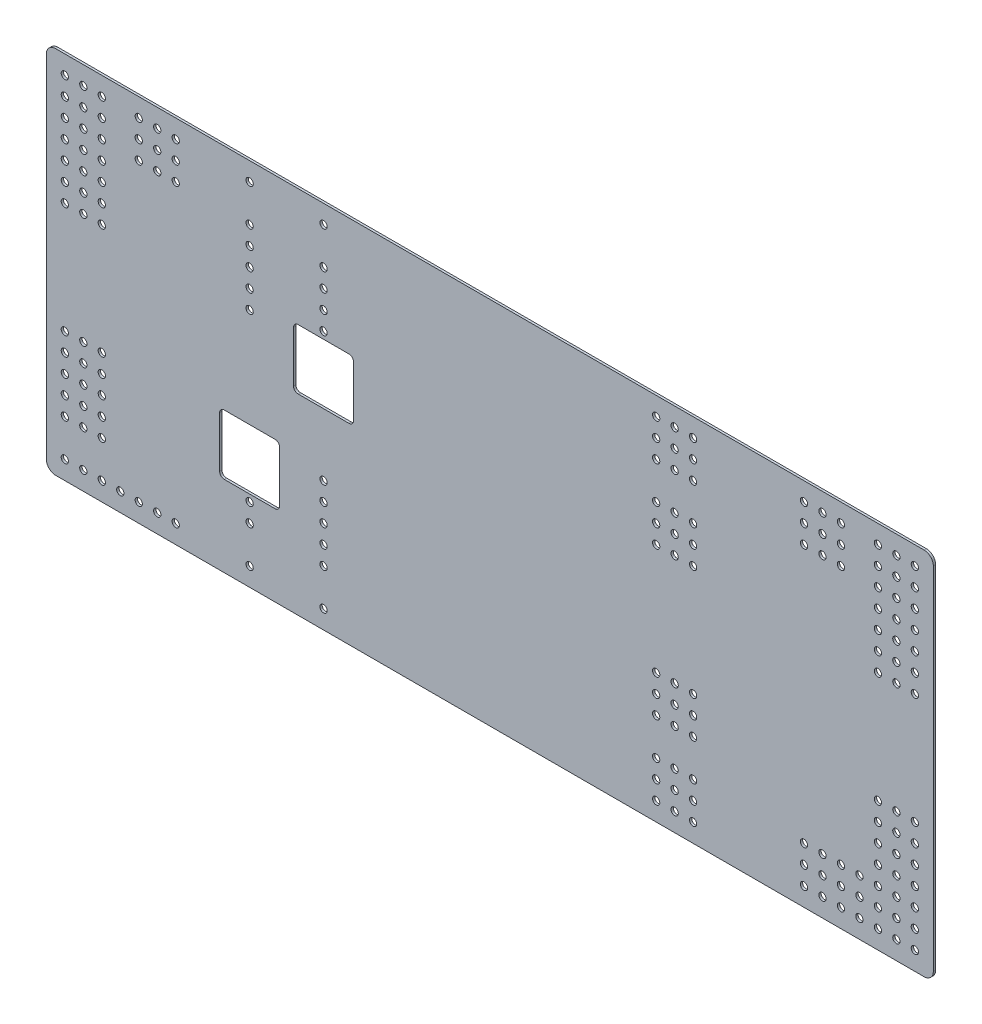
from build123d import *

# Parameters (mm, degrees)
BOSS_EXTRUDE1_DEPTH = 1.5875
SKETCH2_R           = 2.5
CUT_EXTRUDE1_DEPTH  = 474.010623106
CUT_EXTRUDE2_DEPTH  = 474.010623106


with BuildPart() as part:
    # Sketch1 → Boss-Extrude1 (new body)
    with BuildSketch(Plane.XY):
        with BuildLine():
            Line((-148.965673289, 122.233995585), (447.934326711, 122.233995585))
            ThreePointArc((447.934326711, 122.233995585), (452.424454771, 120.374123646), (454.284326711, 115.883995585))
            Line((454.284326711, 115.883995585), (454.284326711, -125.416004415))
            ThreePointArc((454.284326711, -125.416004415), (452.424454771, -129.906132476), (447.934326711, -131.766004415))
            Line((447.934326711, -131.766004415), (-148.965673289, -131.766004415))
            ThreePointArc((-148.965673289, -131.766004415), (-153.45580135, -129.906132476), (-155.315673289, -125.416004415))
            Line((-155.315673289, -125.416004415), (-155.315673289, 115.883995585))
            ThreePointArc((-155.315673289, 115.883995585), (-153.45580135, 120.374123646), (-148.965673289, 122.233995585))
        make_face()
    extrude(amount=BOSS_EXTRUDE1_DEPTH)

    # Sketch2 → Cut-Extrude1 (cut, through all)
    with BuildSketch(Plane.XY.offset(1.5875)):
        with Locations((-142.615673289, 109.533995585)):
            Circle(SKETCH2_R)
        with Locations((-129.915673289, 109.533995585)):
            Circle(SKETCH2_R)
        with Locations((-117.215673289, 109.533995585)):
            Circle(SKETCH2_R)
        with Locations((-91.815673289, 109.533995585)):
            Circle(SKETCH2_R)
        with Locations((-79.115673289, 109.533995585)):
            Circle(SKETCH2_R)
        with Locations((-66.415673289, 109.533995585)):
            Circle(SKETCH2_R)
        with Locations((-129.915673289, 96.833995585)):
            Circle(SKETCH2_R)
        with Locations((-117.215673289, 96.833995585)):
            Circle(SKETCH2_R)
        with Locations((-91.815673289, 96.833995585)):
            Circle(SKETCH2_R)
        with Locations((-79.115673289, 96.833995585)):
            Circle(SKETCH2_R)
        with Locations((-66.415673289, 96.833995585)):
            Circle(SKETCH2_R)
        with Locations((-129.915673289, 84.133995585)):
            Circle(SKETCH2_R)
        with Locations((-117.215673289, 84.133995585)):
            Circle(SKETCH2_R)
        with Locations((-91.815673289, 84.133995585)):
            Circle(SKETCH2_R)
        with Locations((-79.115673289, 84.133995585)):
            Circle(SKETCH2_R)
        with Locations((-66.415673289, 84.133995585)):
            Circle(SKETCH2_R)
        with Locations((-142.615673289, 96.833995585)):
            Circle(SKETCH2_R)
        with Locations((-142.615673289, 84.133995585)):
            Circle(SKETCH2_R)
        with Locations((-142.615673289, 71.433995585)):
            Circle(SKETCH2_R)
        with Locations((-129.915673289, 71.433995585)):
            Circle(SKETCH2_R)
        with Locations((-117.215673289, 71.433995585)):
            Circle(SKETCH2_R)
        with Locations((-129.915673289, 58.733995585)):
            Circle(SKETCH2_R)
        with Locations((-117.215673289, 58.733995585)):
            Circle(SKETCH2_R)
        with Locations((-129.915673289, 46.033995585)):
            Circle(SKETCH2_R)
        with Locations((-117.215673289, 46.033995585)):
            Circle(SKETCH2_R)
        with Locations((-129.915673289, 33.333995585)):
            Circle(SKETCH2_R)
        with Locations((-117.215673289, 33.333995585)):
            Circle(SKETCH2_R)
        with Locations((-142.615673289, 58.733995585)):
            Circle(SKETCH2_R)
        with Locations((-142.615673289, 46.033995585)):
            Circle(SKETCH2_R)
        with Locations((-142.615673289, 33.333995585)):
            Circle(SKETCH2_R)
        with Locations((-142.615673289, -42.866004415)):
            Circle(SKETCH2_R)
        with Locations((-142.615673289, -55.566004415)):
            Circle(SKETCH2_R)
        with Locations((-142.615673289, -68.266004415)):
            Circle(SKETCH2_R)
        with Locations((-117.215673289, -42.866004415)):
            Circle(SKETCH2_R)
        with Locations((-129.915673289, -42.866004415)):
            Circle(SKETCH2_R)
        with Locations((-117.215673289, -55.566004415)):
            Circle(SKETCH2_R)
        with Locations((-129.915673289, -55.566004415)):
            Circle(SKETCH2_R)
        with Locations((-117.215673289, -68.266004415)):
            Circle(SKETCH2_R)
        with Locations((-129.915673289, -68.266004415)):
            Circle(SKETCH2_R)
        with Locations((-117.215673289, -80.966004415)):
            Circle(SKETCH2_R)
        with Locations((-129.915673289, -80.966004415)):
            Circle(SKETCH2_R)
        with Locations((-142.615673289, -80.966004415)):
            Circle(SKETCH2_R)
        with Locations((-142.615673289, -93.666004415)):
            Circle(SKETCH2_R)
        with Locations((-117.215673289, -93.666004415)):
            Circle(SKETCH2_R)
        with Locations((-129.915673289, -93.666004415)):
            Circle(SKETCH2_R)
        with Locations((-66.415673289, -119.066004415)):
            Circle(SKETCH2_R)
        with Locations((-79.115673289, -119.066004415)):
            Circle(SKETCH2_R)
        with Locations((-91.815673289, -119.066004415)):
            Circle(SKETCH2_R)
        with Locations((-104.515673289, -119.066004415)):
            Circle(SKETCH2_R)
        with Locations((-117.215673289, -119.066004415)):
            Circle(SKETCH2_R)
        with Locations((-129.915673289, -119.066004415)):
            Circle(SKETCH2_R)
        with Locations((-142.615673289, -119.066004415)):
            Circle(SKETCH2_R)
        with Locations((441.584326711, -119.066004415)):
            Circle(SKETCH2_R)
        with Locations((428.884326711, -119.066004415)):
            Circle(SKETCH2_R)
        with Locations((416.184326711, -119.066004415)):
            Circle(SKETCH2_R)
        with Locations((403.484326711, -119.066004415)):
            Circle(SKETCH2_R)
        with Locations((390.784326711, -119.066004415)):
            Circle(SKETCH2_R)
        with Locations((378.084326711, -119.066004415)):
            Circle(SKETCH2_R)
        with Locations((365.384326711, -119.066004415)):
            Circle(SKETCH2_R)
        with Locations((428.884326711, -106.366004415)):
            Circle(SKETCH2_R)
        with Locations((416.184326711, -106.366004415)):
            Circle(SKETCH2_R)
        with Locations((403.484326711, -106.366004415)):
            Circle(SKETCH2_R)
        with Locations((390.784326711, -106.366004415)):
            Circle(SKETCH2_R)
        with Locations((378.084326711, -106.366004415)):
            Circle(SKETCH2_R)
        with Locations((365.384326711, -106.366004415)):
            Circle(SKETCH2_R)
        with Locations((428.884326711, -93.666004415)):
            Circle(SKETCH2_R)
        with Locations((416.184326711, -93.666004415)):
            Circle(SKETCH2_R)
        with Locations((403.484326711, -93.666004415)):
            Circle(SKETCH2_R)
        with Locations((390.784326711, -93.666004415)):
            Circle(SKETCH2_R)
        with Locations((378.084326711, -93.666004415)):
            Circle(SKETCH2_R)
        with Locations((365.384326711, -93.666004415)):
            Circle(SKETCH2_R)
        with Locations((441.584326711, -106.366004415)):
            Circle(SKETCH2_R)
        with Locations((441.584326711, -93.666004415)):
            Circle(SKETCH2_R)
        with Locations((441.584326711, -80.966004415)):
            Circle(SKETCH2_R)
        with Locations((428.884326711, -80.966004415)):
            Circle(SKETCH2_R)
        with Locations((416.184326711, -80.966004415)):
            Circle(SKETCH2_R)
        with Locations((428.884326711, -68.266004415)):
            Circle(SKETCH2_R)
        with Locations((416.184326711, -68.266004415)):
            Circle(SKETCH2_R)
        with Locations((428.884326711, -55.566004415)):
            Circle(SKETCH2_R)
        with Locations((416.184326711, -55.566004415)):
            Circle(SKETCH2_R)
        with Locations((428.884326711, -42.866004415)):
            Circle(SKETCH2_R)
        with Locations((416.184326711, -42.866004415)):
            Circle(SKETCH2_R)
        with Locations((441.584326711, -68.266004415)):
            Circle(SKETCH2_R)
        with Locations((441.584326711, -55.566004415)):
            Circle(SKETCH2_R)
        with Locations((441.584326711, -42.866004415)):
            Circle(SKETCH2_R)
        with Locations((441.584326711, 33.333995585)):
            Circle(SKETCH2_R)
        with Locations((441.584326711, 46.033995585)):
            Circle(SKETCH2_R)
        with Locations((441.584326711, 58.733995585)):
            Circle(SKETCH2_R)
        with Locations((416.184326711, 33.333995585)):
            Circle(SKETCH2_R)
        with Locations((416.184326711, 46.033995585)):
            Circle(SKETCH2_R)
        with Locations((416.184326711, 58.733995585)):
            Circle(SKETCH2_R)
        with Locations((416.184326711, 71.433995585)):
            Circle(SKETCH2_R)
        with Locations((441.584326711, 71.433995585)):
            Circle(SKETCH2_R)
        with Locations((441.584326711, 84.133995585)):
            Circle(SKETCH2_R)
        with Locations((441.584326711, 96.833995585)):
            Circle(SKETCH2_R)
        with Locations((365.384326711, 84.133995585)):
            Circle(SKETCH2_R)
        with Locations((378.084326711, 84.133995585)):
            Circle(SKETCH2_R)
        with Locations((390.784326711, 84.133995585)):
            Circle(SKETCH2_R)
        with Locations((416.184326711, 84.133995585)):
            Circle(SKETCH2_R)
        with Locations((428.884326711, 84.133995585)):
            Circle(SKETCH2_R)
        with Locations((365.384326711, 96.833995585)):
            Circle(SKETCH2_R)
        with Locations((378.084326711, 96.833995585)):
            Circle(SKETCH2_R)
        with Locations((390.784326711, 96.833995585)):
            Circle(SKETCH2_R)
        with Locations((416.184326711, 96.833995585)):
            Circle(SKETCH2_R)
        with Locations((428.884326711, 96.833995585)):
            Circle(SKETCH2_R)
        with Locations((365.384326711, 109.533995585)):
            Circle(SKETCH2_R)
        with Locations((378.084326711, 109.533995585)):
            Circle(SKETCH2_R)
        with Locations((390.784326711, 109.533995585)):
            Circle(SKETCH2_R)
        with Locations((416.184326711, 109.533995585)):
            Circle(SKETCH2_R)
        with Locations((428.884326711, 109.533995585)):
            Circle(SKETCH2_R)
        with Locations((441.584326711, 109.533995585)):
            Circle(SKETCH2_R)
        with Locations((-15.615673289, 109.533995585)):
            Circle(SKETCH2_R)
        with Locations((35.184326711, 109.533995585)):
            Circle(SKETCH2_R)
        with Locations((-15.615673289, 84.133995585)):
            Circle(SKETCH2_R)
        with Locations((35.184326711, 84.133995585)):
            Circle(SKETCH2_R)
        with Locations((-15.615673289, 71.433995585)):
            Circle(SKETCH2_R)
        with Locations((35.184326711, 71.433995585)):
            Circle(SKETCH2_R)
        with Locations((-15.615673289, 58.733995585)):
            Circle(SKETCH2_R)
        with Locations((35.184326711, 58.733995585)):
            Circle(SKETCH2_R)
        with Locations((-15.615673289, 46.033995585)):
            Circle(SKETCH2_R)
        with Locations((35.184326711, 46.033995585)):
            Circle(SKETCH2_R)
        with Locations((-15.615673289, 33.333995585)):
            Circle(SKETCH2_R)
        with Locations((35.184326711, 33.333995585)):
            Circle(SKETCH2_R)
        with Locations((35.184326711, -42.866004415)):
            Circle(SKETCH2_R)
        with Locations((-15.615673289, -42.866004415)):
            Circle(SKETCH2_R)
        with Locations((35.184326711, -55.566004415)):
            Circle(SKETCH2_R)
        with Locations((-15.615673289, -55.566004415)):
            Circle(SKETCH2_R)
        with Locations((35.184326711, -68.266004415)):
            Circle(SKETCH2_R)
        with Locations((-15.615673289, -68.266004415)):
            Circle(SKETCH2_R)
        with Locations((35.184326711, -80.966004415)):
            Circle(SKETCH2_R)
        with Locations((-15.615673289, -80.966004415)):
            Circle(SKETCH2_R)
        with Locations((35.184326711, -93.666004415)):
            Circle(SKETCH2_R)
        with Locations((-15.615673289, -93.666004415)):
            Circle(SKETCH2_R)
        with Locations((35.184326711, -119.066004415)):
            Circle(SKETCH2_R)
        with Locations((-15.615673289, -119.066004415)):
            Circle(SKETCH2_R)
        with Locations((289.184326711, 109.533995585)):
            Circle(SKETCH2_R)
        with Locations((276.484326711, 109.533995585)):
            Circle(SKETCH2_R)
        with Locations((263.784326711, 109.533995585)):
            Circle(SKETCH2_R)
        with Locations((276.484326711, 96.833995585)):
            Circle(SKETCH2_R)
        with Locations((263.784326711, 96.833995585)):
            Circle(SKETCH2_R)
        with Locations((276.484326711, 84.133995585)):
            Circle(SKETCH2_R)
        with Locations((263.784326711, 84.133995585)):
            Circle(SKETCH2_R)
        with Locations((276.484326711, 58.733995585)):
            Circle(SKETCH2_R)
        with Locations((263.784326711, 58.733995585)):
            Circle(SKETCH2_R)
        with Locations((276.484326711, 46.033995585)):
            Circle(SKETCH2_R)
        with Locations((263.784326711, 46.033995585)):
            Circle(SKETCH2_R)
        with Locations((276.484326711, 33.333995585)):
            Circle(SKETCH2_R)
        with Locations((263.784326711, 33.333995585)):
            Circle(SKETCH2_R)
        with Locations((289.184326711, 96.833995585)):
            Circle(SKETCH2_R)
        with Locations((289.184326711, 84.133995585)):
            Circle(SKETCH2_R)
        with Locations((289.184326711, 58.733995585)):
            Circle(SKETCH2_R)
        with Locations((289.184326711, 46.033995585)):
            Circle(SKETCH2_R)
        with Locations((289.184326711, 33.333995585)):
            Circle(SKETCH2_R)
        with Locations((289.184326711, -42.866004415)):
            Circle(SKETCH2_R)
        with Locations((289.184326711, -55.566004415)):
            Circle(SKETCH2_R)
        with Locations((289.184326711, -68.266004415)):
            Circle(SKETCH2_R)
        with Locations((289.184326711, -106.366004415)):
            Circle(SKETCH2_R)
        with Locations((263.784326711, -42.866004415)):
            Circle(SKETCH2_R)
        with Locations((276.484326711, -42.866004415)):
            Circle(SKETCH2_R)
        with Locations((263.784326711, -55.566004415)):
            Circle(SKETCH2_R)
        with Locations((276.484326711, -55.566004415)):
            Circle(SKETCH2_R)
        with Locations((263.784326711, -68.266004415)):
            Circle(SKETCH2_R)
        with Locations((276.484326711, -68.266004415)):
            Circle(SKETCH2_R)
        with Locations((263.784326711, -106.366004415)):
            Circle(SKETCH2_R)
        with Locations((276.484326711, -106.366004415)):
            Circle(SKETCH2_R)
        with Locations((263.784326711, -119.066004415)):
            Circle(SKETCH2_R)
        with Locations((276.484326711, -119.066004415)):
            Circle(SKETCH2_R)
        with Locations((289.184326711, -119.066004415)):
            Circle(SKETCH2_R)
        with Locations((428.884326711, 71.433995585)):
            Circle(SKETCH2_R)
        with Locations((428.884326711, 58.733995585)):
            Circle(SKETCH2_R)
        with Locations((428.884326711, 46.033995585)):
            Circle(SKETCH2_R)
        with Locations((428.884326711, 33.333995585)):
            Circle(SKETCH2_R)
        with Locations((289.184326711, -93.666004415)):
            Circle(SKETCH2_R)
        with Locations((276.484326711, -93.666004415)):
            Circle(SKETCH2_R)
        with Locations((263.784326711, -93.666004415)):
            Circle(SKETCH2_R)
    extrude(amount=-CUT_EXTRUDE1_DEPTH, mode=Mode.SUBTRACT)

    # Sketch3 → Cut-Extrude2 (cut, through all)
    with BuildSketch(Plane(origin=(0, 0, 0), x_dir=(-1, 0, 0), z_dir=(0, 0, -1))):
        with BuildLine():
            Line((-1.846826711, -34.928504415), (33.078173289, -34.928504415))
            ThreePointArc((33.078173289, -34.928504415), (35.323237319, -35.858440385), (36.253173289, -38.103504415))
            Line((36.253173289, -38.103504415), (36.253173289, -73.028504415))
            ThreePointArc((36.253173289, -73.028504415), (35.323237319, -75.273568445), (33.078173289, -76.203504415))
            Line((33.078173289, -76.203504415), (-1.846826711, -76.203504415))
            ThreePointArc((-1.846826711, -76.203504415), (-4.091890741, -75.273568445), (-5.021826711, -73.028504415))
            Line((-5.021826711, -73.028504415), (-5.021826711, -38.103504415))
            ThreePointArc((-5.021826711, -38.103504415), (-4.091890741, -35.858440385), (-1.846826711, -34.928504415))
        make_face()
        with BuildLine():
            Line((-52.646826711, 41.271495585), (-17.721826711, 41.271495585))
            ThreePointArc((-17.721826711, 41.271495585), (-15.476762681, 40.341559615), (-14.546826711, 38.096495585))
            Line((-14.546826711, 38.096495585), (-14.546826711, 3.171495585))
            ThreePointArc((-14.546826711, 3.171495585), (-15.476762681, 0.926431555), (-17.721826711, -0.003504415))
            Line((-17.721826711, -0.003504415), (-52.646826711, -0.003504415))
            ThreePointArc((-52.646826711, -0.003504415), (-54.891890741, 0.926431555), (-55.821826711, 3.171495585))
            Line((-55.821826711, 3.171495585), (-55.821826711, 38.096495585))
            ThreePointArc((-55.821826711, 38.096495585), (-54.891890741, 40.341559615), (-52.646826711, 41.271495585))
        make_face()
    extrude(amount=-CUT_EXTRUDE2_DEPTH, mode=Mode.SUBTRACT)


solid = part.part
